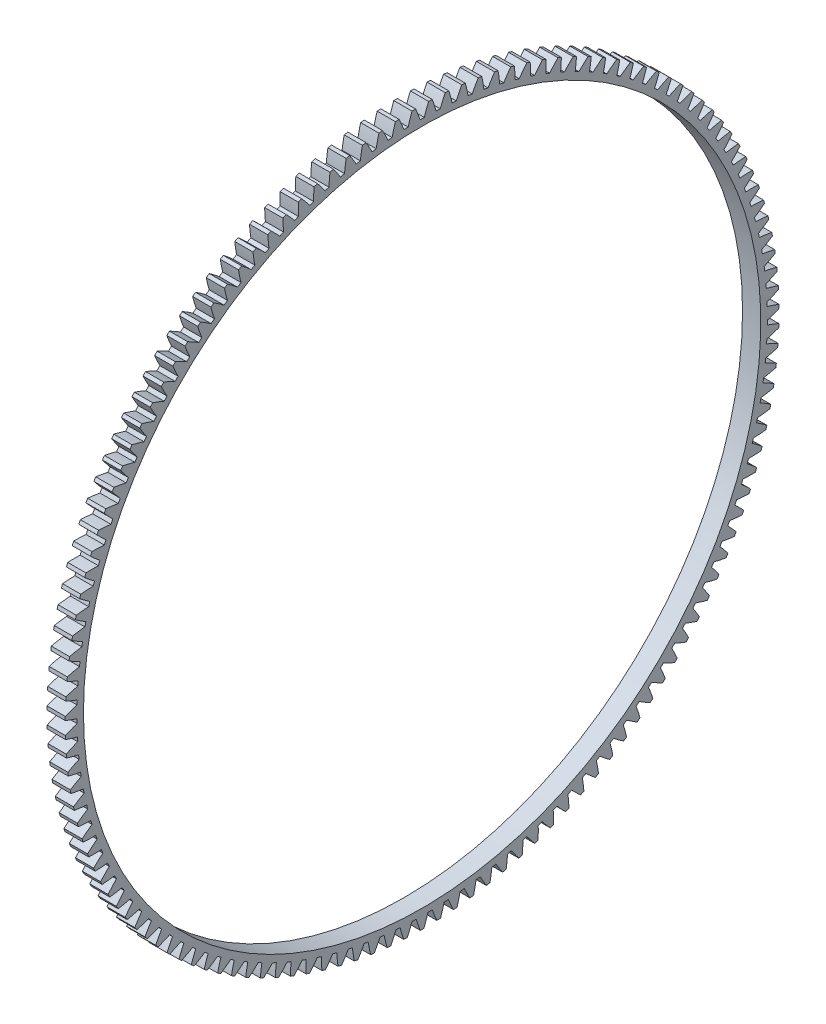
from build123d import *

# Parameters (mm, degrees)
BASPROSKE_W     = 7
BASPROSKE_H     = 137
TOOTHCUT_DEPTH  = 194.873670208
TEETHCUTS_COUNT = 135
TEETHCUTS_ANGLE = 357.333333333
BORSKE_R        = 130
BORE_DEPTH      = 50.0000508


with BuildPart() as part:
    # BasProSke → Base-Revolve (revolve)
    with BuildSketch(Plane(origin=(0, 0, 0), x_dir=(1, 0, 0), z_dir=(0, 1, 0))):
        with Locations((3.5, 68.5)):
            Rectangle(BASPROSKE_W, BASPROSKE_H)
    revolve(axis=Axis((-10, 0, 0), (1, 0, 0)))

    # TooCutSke → ToothCut (cut, through all)
    with BuildSketch(Plane(origin=(0, 0, 0), x_dir=(0, 0, -1), z_dir=(1, 0, 0))):
        with BuildLine():
            ThreePointArc((0.801850769, 132.496573678), (0, 132.499), (-0.801850769, 132.496573678))
            ThreePointArc((-0.801850769, 132.496573678), (-1.603886882, 134.768542748), (-2.506470423, 137.002473887))
            ThreePointArc((-2.506470423, 137.002473887), (0, 137.0254), (2.506470423, 137.002473887))
            ThreePointArc((2.506470423, 137.002473887), (1.603886882, 134.768542748), (0.801850769, 132.496573678))
        make_face()
    toothcut = extrude(amount=TOOTHCUT_DEPTH, mode=Mode.SUBTRACT)

    # TeethCuts: ToothCut ×135 about axis
    teethcuts_axis = Axis((-10, 0, 0), (1, 0, 0))
    for i in range(1, TEETHCUTS_COUNT):
        add(toothcut.rotate(teethcuts_axis, i * TEETHCUTS_ANGLE / (TEETHCUTS_COUNT - 1)), mode=Mode.SUBTRACT)

    # BorSke → Bore (cut, symmetric)
    with BuildSketch(Plane(origin=(0, 0, 0), x_dir=(0, 0, -1), z_dir=(1, 0, 0))):
        Circle(BORSKE_R)
    extrude(amount=BORE_DEPTH, both=True, mode=Mode.SUBTRACT)


solid = part.part
